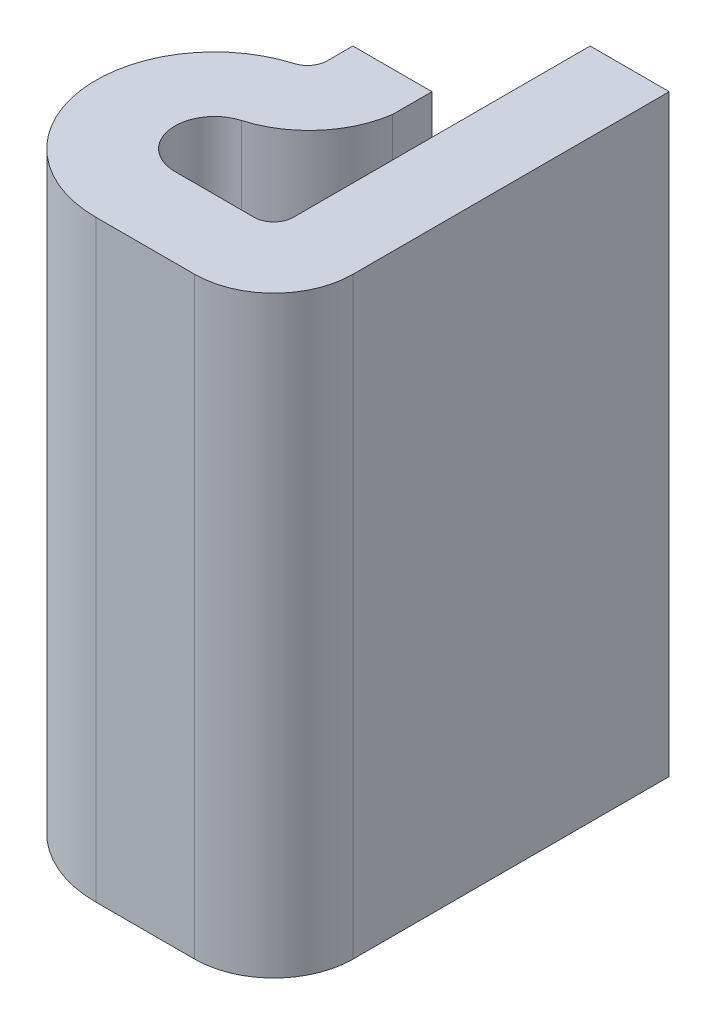
from build123d import *

# Parameters (mm, degrees)
BOSS_EXTRUDE1_DEPTH      = 7.5
BOSS_EXTRUDE1_DEPTH_BACK = 7.5


with BuildPart() as part:
    # Sketch1 → Boss-Extrude1 (new, two sides: drawn at the far end of the back side and taken through both)
    with BuildSketch(Plane.XZ.offset(-16.5).offset(-BOSS_EXTRUDE1_DEPTH_BACK)):
        with BuildLine():
            Line((32.25, 34.5), (32.25, 35.5))
            ThreePointArc((32.25, 35.5), (31.660669064, 36.78109942), (30.471806841, 37.539474849))
            ThreePointArc((30.471806841, 37.539474849), (29.759917895, 38.640489944), (30.75, 39.5))
            Line((30.75, 39.5), (32.75, 39.5))
            ThreePointArc((32.75, 39.5), (33.103553391, 39.353553391), (33.25, 39))
            Line((33.25, 39), (33.25, 31.5))
            Line((33.25, 31.5), (35.25, 31.5))
            Line((35.25, 31.5), (35.25, 39.5))
            ThreePointArc((35.25, 39.5), (34.664213562, 40.914213562), (33.25, 41.5))
            Line((33.25, 41.5), (30.75, 41.5))
            ThreePointArc((30.75, 41.5), (27.781428489, 38.933108746), (29.892857143, 35.625055458))
            ThreePointArc((29.892857143, 35.625055458), (30.150891863, 35.444705186), (30.25, 35.145898034))
            Line((30.25, 35.145898034), (30.25, 34.5))
            Line((30.25, 34.5), (32.25, 34.5))
        make_face()
    extrude(amount=BOSS_EXTRUDE1_DEPTH + BOSS_EXTRUDE1_DEPTH_BACK)


solid = part.part
